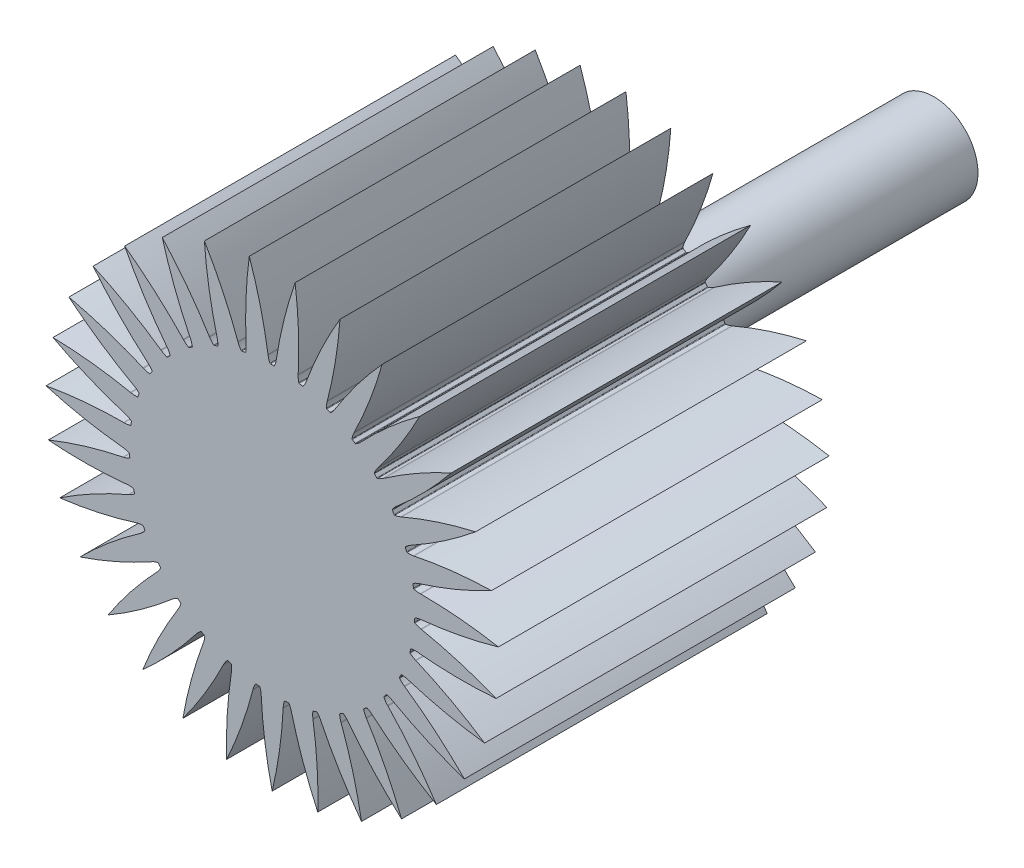
from build123d import *

# Parameters (mm, degrees)
SKETCH1_R                = 500
EXTRUDE1_DEPTH           = 300
CUT_EXTRUDE1_DEPTH       = 769.114574787
FILLET1_R                = 0.635
CIRPATTERN1_COUNT        = 31
FILLET1_OF_CIRPATTERN1_R = 0.635
SKETCH3_R                = 40
EXTRUDE2_DEPTH           = 300


with BuildPart() as part:
    # Sketch1 → Extrude1 (new body)
    with BuildSketch(Plane.XY):
        Circle(SKETCH1_R)
    extrude(amount=EXTRUDE1_DEPTH)

    # Sketch2 → Cut-Extrude1 (cut, symmetric)
    with BuildSketch(Plane.XY.offset(300)):
        with BuildLine():
            Line((-2460.940364062, 1353.146977655), (-241.231460808, 437.958196997))
            ThreePointArc((-241.231460808, 437.958196997), (-82.810970136, 318.022108626), (-3.81, 135.702159428))
            Line((-3.81, 135.702159428), (-3.732214889, 135.194159428))
            ThreePointArc((-3.732214889, 135.194159428), (-3.039845854, 132.203962215), (-1.905, 129.352159428))
            ThreePointArc((-1.905, 129.352159428), (0, 129.366186361), (1.905, 129.352159428))
            ThreePointArc((1.905, 129.352159428), (3.039845854, 132.203962215), (3.732214889, 135.194159428))
            Line((3.732214889, 135.194159428), (3.81, 135.702159428))
            ThreePointArc((3.81, 135.702159428), (82.810970136, 318.022108626), (241.231460808, 437.958196997))
            Line((241.231460808, 437.958196997), (2460.940364062, 1353.146977655))
            Line((2460.940364062, 1353.146977655), (2460.940364062, 6155.095798467))
            Line((2460.940364062, 6155.095798467), (-2460.940364062, 6155.095798467))
            Line((-2460.940364062, 6155.095798467), (-2460.940364062, 1353.146977655))
        make_face()
    cut_extrude1 = extrude(amount=CUT_EXTRUDE1_DEPTH, both=True, mode=Mode.SUBTRACT)

    # Fillet1
    fillet1_edges = [part.edges().sort_by_distance(p)[0] for p in [
        (1.905, 129.352159428, 150),
        (-1.905, 129.352159428, 150),
    ]]
    fillet(fillet1_edges, radius=FILLET1_R)

    # CirPattern1: Cut-Extrude1 ×31 about axis
    cirpattern1_axis = Axis((0, 0, 300), (0, 0, -1))
    for i in range(1, CIRPATTERN1_COUNT):
        add(cut_extrude1.rotate(cirpattern1_axis, i * 360 / CIRPATTERN1_COUNT), mode=Mode.SUBTRACT)

    # Fillet1 of CirPattern1
    fillet1_of_cirpattern1_edges = [part.edges().sort_by_distance(p)[0] for p in [
        (27.904402801, 126.320839444, 150),
        (24.172393725, 127.087786806, 150),
        (52.761396073, 118.117929452, 150),
        (49.260166811, 119.62042526, 150),
        (75.45833159, 105.07925755, 150),
        (72.331222879, 107.255789449, 150),
        (95.065994147, 87.738628497, 150),
        (92.441030185, 90.500089016, 150),
        (110.781643733, 66.805969685, 150),
        (108.766290853, 70.039304306, 150),
        (121.961879808, 43.138266624, 150),
        (120.638646795, 46.711102248, 150),
        (128.148982194, 17.70447786, 150),
        (127.572042362, 21.470542175, 150),
        (129.089650192, -8.454134309, 150),
        (129.282623525, -4.649024416, 150),
        (124.745372744, -34.266633225, 150),
        (125.700358892, -30.578259402, 150),
        (115.294005079, -58.676252151, 150),
        (116.971906796, -55.255616855, 150),
        (101.122487299, -80.68365842, 150),
        (103.454611093, -77.670802862, 150),
        (82.811003008, -99.387866233, 150),
        (85.701871456, -96.906137074, 150),
        (61.109226524, -114.023123125, 150),
        (64.440487132, -112.174122648, 150),
        (36.905631126, -123.990259959, 150),
        (40.540901693, -122.849686461, 150),
        (11.191114854, -128.881220983, 150),
        (14.981566976, -128.495769676, 150),
        (-14.981566976, -128.495769676, 150),
        (-11.191114854, -128.881220983, 150),
        (-40.540901693, -122.849686461, 150),
        (-36.905631126, -123.990259959, 150),
        (-64.440487132, -112.174122648, 150),
        (-61.109226524, -114.023123125, 150),
        (-85.701871456, -96.906137074, 150),
        (-82.811003008, -99.387866233, 150),
        (-103.454611093, -77.670802862, 150),
        (-101.122487299, -80.68365842, 150),
        (-116.971906796, -55.255616855, 150),
        (-115.294005079, -58.676252151, 150),
        (-125.700358892, -30.578259402, 150),
        (-124.745372744, -34.266633225, 150),
        (-129.282623525, -4.649024416, 150),
        (-129.089650192, -8.454134309, 150),
        (-127.572042362, 21.470542175, 150),
        (-128.148982194, 17.70447786, 150),
        (-120.638646795, 46.711102248, 150),
        (-121.961879808, 43.138266624, 150),
        (-108.766290853, 70.039304306, 150),
        (-110.781643733, 66.805969685, 150),
        (-92.441030185, 90.500089016, 150),
        (-95.065994147, 87.738628497, 150),
        (-72.331222879, 107.255789449, 150),
        (-75.45833159, 105.07925755, 150),
        (-49.260166811, 119.62042526, 150),
        (-52.761396073, 118.117929452, 150),
        (-24.172393725, 127.087786806, 150),
        (-27.904402801, 126.320839444, 150),
    ]]
    fillet(fillet1_of_cirpattern1_edges, radius=FILLET1_OF_CIRPATTERN1_R)

    # Sketch3 → Extrude2 (add)
    with BuildSketch(Plane(origin=(0, 0, 0), x_dir=(-1, 0, 0), z_dir=(0, 0, -1))):
        Circle(SKETCH3_R)
    extrude(amount=EXTRUDE2_DEPTH)


solid = part.part
